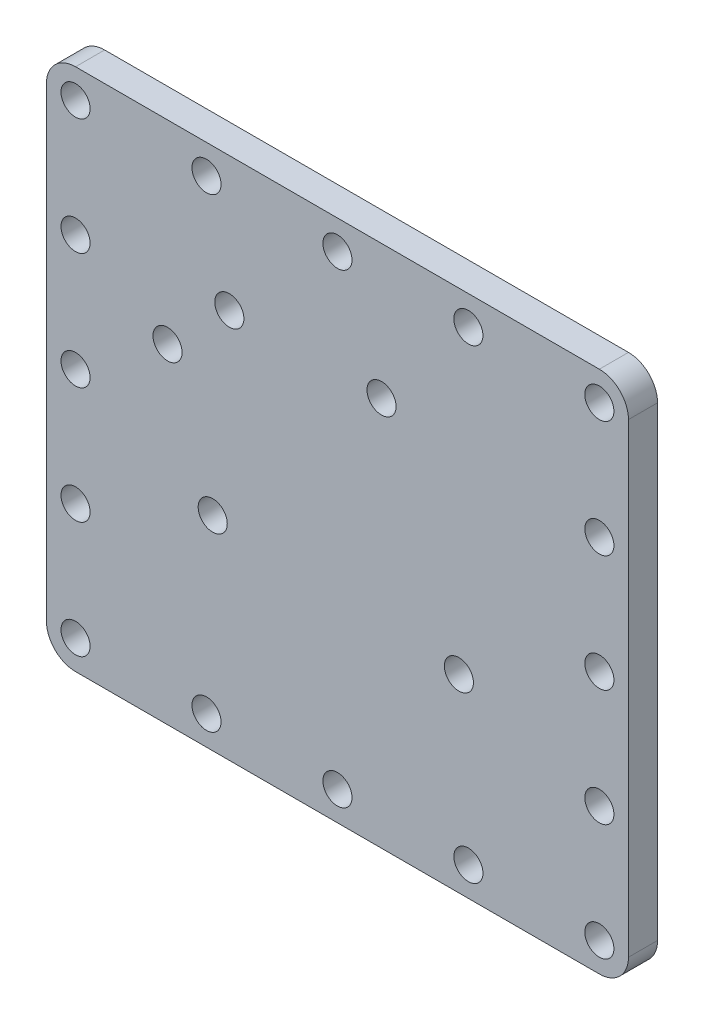
from build123d import *

# Parameters (mm, degrees)
SKETCH_1_R          = 5
EXTRUDE_1_DEPTH     = 5
SKETCH_2_W          = 160
SKETCH_2_H          = 140
CUT_EXTRUDE_1_DEPTH = 1


with BuildPart() as part:
    # 草图1 → 凸台-拉伸1 (new, symmetric)
    with BuildSketch(Plane.XY):
        with BuildLine():
            Line((-90, -90), (90, -90))
            ThreePointArc((90, -90), (97.071067812, -87.071067812), (100, -80))
            Line((100, -80), (100, 80))
            ThreePointArc((100, 80), (97.071067812, 87.071067812), (90, 90))
            Line((90, 90), (-90, 90))
            ThreePointArc((-90, 90), (-97.071067812, 87.071067812), (-100, 80))
            Line((-100, 80), (-100, -80))
            ThreePointArc((-100, -80), (-97.071067812, -87.071067812), (-90, -90))
        make_face()
        with Locations((-90, 80)):
            Circle(SKETCH_1_R, mode=Mode.SUBTRACT)
        with Locations((90, 80)):
            Circle(SKETCH_1_R, mode=Mode.SUBTRACT)
        with Locations((90, -80)):
            Circle(SKETCH_1_R, mode=Mode.SUBTRACT)
        with Locations((-90, -80)):
            Circle(SKETCH_1_R, mode=Mode.SUBTRACT)
        with Locations((-37.156030243, 43.920850966)):
            Circle(SKETCH_1_R, mode=Mode.SUBTRACT)
        with Locations((15.145121023, 43.920850966)):
            Circle(SKETCH_1_R, mode=Mode.SUBTRACT)
        with Locations((-58.386061631, 23.270870328)):
            Circle(SKETCH_1_R, mode=Mode.SUBTRACT)
        with Locations((-42.862802557, -19.941076014)):
            Circle(SKETCH_1_R, mode=Mode.SUBTRACT)
        with Locations((41.733222374, -24.941076014)):
            Circle(SKETCH_1_R, mode=Mode.SUBTRACT)
        with Locations((90, 0)):
            Circle(SKETCH_1_R, mode=Mode.SUBTRACT)
        with Locations((90, 40)):
            Circle(SKETCH_1_R, mode=Mode.SUBTRACT)
        with Locations((90, -40)):
            Circle(SKETCH_1_R, mode=Mode.SUBTRACT)
        with Locations((-90, -40)):
            Circle(SKETCH_1_R, mode=Mode.SUBTRACT)
        with Locations((-90, 0)):
            Circle(SKETCH_1_R, mode=Mode.SUBTRACT)
        with Locations((-90, 40)):
            Circle(SKETCH_1_R, mode=Mode.SUBTRACT)
        with Locations((0, 80)):
            Circle(SKETCH_1_R, mode=Mode.SUBTRACT)
        with Locations((-45, 80)):
            Circle(SKETCH_1_R, mode=Mode.SUBTRACT)
        with Locations((45, 80)):
            Circle(SKETCH_1_R, mode=Mode.SUBTRACT)
        with Locations((45, -80)):
            Circle(SKETCH_1_R, mode=Mode.SUBTRACT)
        with Locations((0, -80)):
            Circle(SKETCH_1_R, mode=Mode.SUBTRACT)
        with Locations((-45, -80)):
            Circle(SKETCH_1_R, mode=Mode.SUBTRACT)
    extrude(amount=EXTRUDE_1_DEPTH, both=True)

    # 草图2 → 切除-拉伸1 (cut)
    with BuildSketch(Plane(origin=(0, 0, -5), x_dir=(-1, 0, 0), z_dir=(0, 0, -1))):
        Rectangle(SKETCH_2_W, SKETCH_2_H)
    extrude(amount=-CUT_EXTRUDE_1_DEPTH, mode=Mode.SUBTRACT)


solid = part.part
